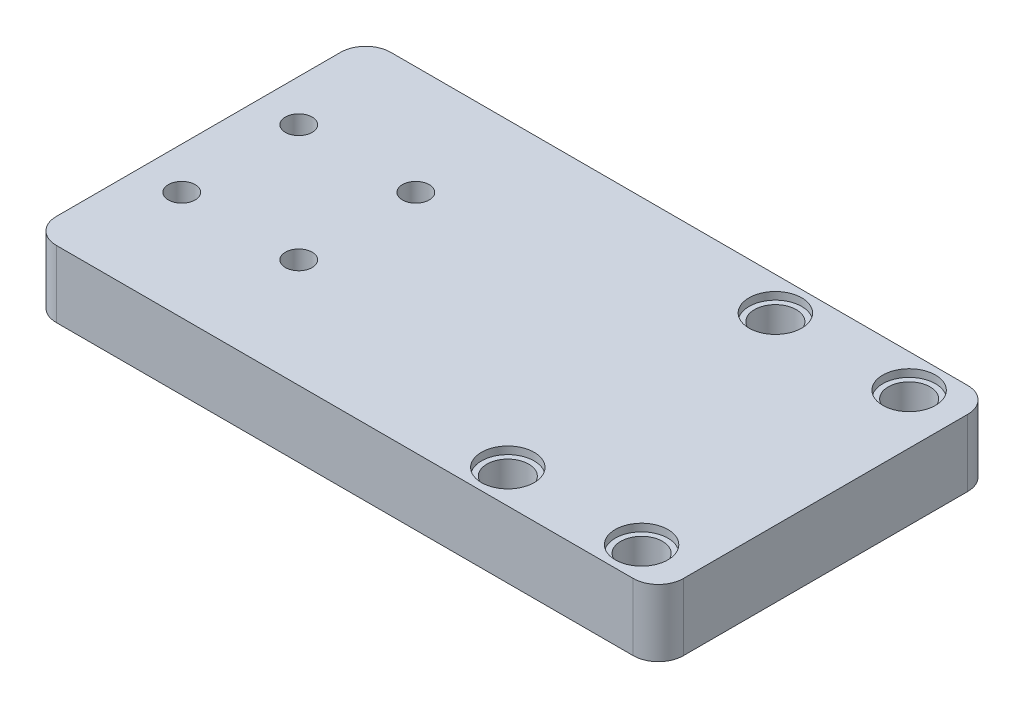
from build123d import *

# Parameters (mm, degrees)
SKETCH_1_W                  = 75
SKETCH_1_H                  = 40
EXTRUDE_1_DEPTH             = 8
SKETCH_2_R                  = 1.6
SKETCH_2_R_2                = 2.5
CUT_EXTRUDE_1_DEPTH         = 8
SKETCH_3_R                  = 3.15
CUT_EXTRUDE_2_DEPTH         = 0.9
PATTERN_LINEAR_1_COUNT      = 2
PATTERN_LINEAR_1_PITCH      = 16
PATTERN_LINEAR_1_COUNT_DIR2 = 2
PATTERN_LINEAR_1_PITCH_DIR2 = 32
MIRROR_1_COPY_1_SKETCH_R    = 3.15
MIRROR_1_COPY_1_DEPTH       = 0.9
MIRROR_1_COPY_2_SKETCH_R    = 3.15
MIRROR_1_COPY_2_DEPTH       = 0.9
MIRROR_1_COPY_3_SKETCH_R    = 3.15
MIRROR_1_COPY_3_DEPTH       = 0.9
FILLET_1_R                  = 3


with BuildPart() as part:
    # 草图1 → 凸台-拉伸1 (new body)
    with BuildSketch(Plane(origin=(0, 0, 0), x_dir=(1, 0, 0), z_dir=(0, 1, 0))):
        Rectangle(SKETCH_1_W, SKETCH_1_H)
    extrude(amount=EXTRUDE_1_DEPTH)

    # 草图2 → 切除-拉伸1 (cut)
    with BuildSketch(Plane(origin=(0, 8, 0), x_dir=(1, 0, 0), z_dir=(0, 1, 0))):
        with Locations((-32.5, 7)):
            Circle(SKETCH_2_R)
        with Locations((15.5, 16)):
            Circle(SKETCH_2_R_2)
        with Locations((-18.5, 7)):
            Circle(SKETCH_2_R)
        with Locations((-18.5, -7)):
            Circle(SKETCH_2_R)
        with Locations((-32.5, -7)):
            Circle(SKETCH_2_R)
        with Locations((31.5, 16)):
            Circle(SKETCH_2_R_2)
        with Locations((31.5, -16)):
            Circle(SKETCH_2_R_2)
        with Locations((15.5, -16)):
            Circle(SKETCH_2_R_2)
    extrude(amount=-CUT_EXTRUDE_1_DEPTH, mode=Mode.SUBTRACT)

    # 草图3 → 切除-拉伸2 (cut)
    with BuildSketch(Plane(origin=(0, 8, 0), x_dir=(1, 0, 0), z_dir=(0, 1, 0))):
        with Locations((15.5, 16)):
            Circle(SKETCH_3_R)
    cut_extrude_2 = extrude(amount=-CUT_EXTRUDE_2_DEPTH, mode=Mode.SUBTRACT)

    # 阵列(线性)1: Cut-Extrude 2 2 × 2
    with Locations(*[(i * PATTERN_LINEAR_1_PITCH, 0, j * PATTERN_LINEAR_1_PITCH_DIR2) for i in range(PATTERN_LINEAR_1_COUNT) for j in range(PATTERN_LINEAR_1_COUNT_DIR2) if (i, j) != (0, 0)]):
        add(cut_extrude_2, mode=Mode.SUBTRACT)

    # 镜向1: 切除-拉伸2 across plane
    add(cut_extrude_2.mirror(Plane.ZX.offset(4)), mode=Mode.SUBTRACT)

    # 镜向1 copy 1 sketch → 镜向1 copy 1 (cut)
    with BuildSketch(Plane(origin=(0, 0, 32), x_dir=(1, 0, 0), z_dir=(0, -1, 0))):
        with Locations((15.5, -16)):
            Circle(MIRROR_1_COPY_1_SKETCH_R)
    extrude(amount=-MIRROR_1_COPY_1_DEPTH, mode=Mode.SUBTRACT)

    # 镜向1 copy 2 sketch → 镜向1 copy 2 (cut)
    with BuildSketch(Plane(origin=(16, 0, 0), x_dir=(1, 0, 0), z_dir=(0, -1, 0))):
        with Locations((15.5, -16)):
            Circle(MIRROR_1_COPY_2_SKETCH_R)
    extrude(amount=-MIRROR_1_COPY_2_DEPTH, mode=Mode.SUBTRACT)

    # 镜向1 copy 3 sketch → 镜向1 copy 3 (cut)
    with BuildSketch(Plane(origin=(16, 0, 32), x_dir=(1, 0, 0), z_dir=(0, -1, 0))):
        with Locations((15.5, -16)):
            Circle(MIRROR_1_COPY_3_SKETCH_R)
    extrude(amount=-MIRROR_1_COPY_3_DEPTH, mode=Mode.SUBTRACT)

    # 圆角1
    fillet_1_edges = [part.edges().sort_by_distance(p)[0] for p in [
        (-37.5, 4, 20),
        (37.5, 4, 20),
        (-37.5, 4, -20),
        (37.5, 4, -20),
    ]]
    fillet(fillet_1_edges, radius=FILLET_1_R)


solid = part.part
